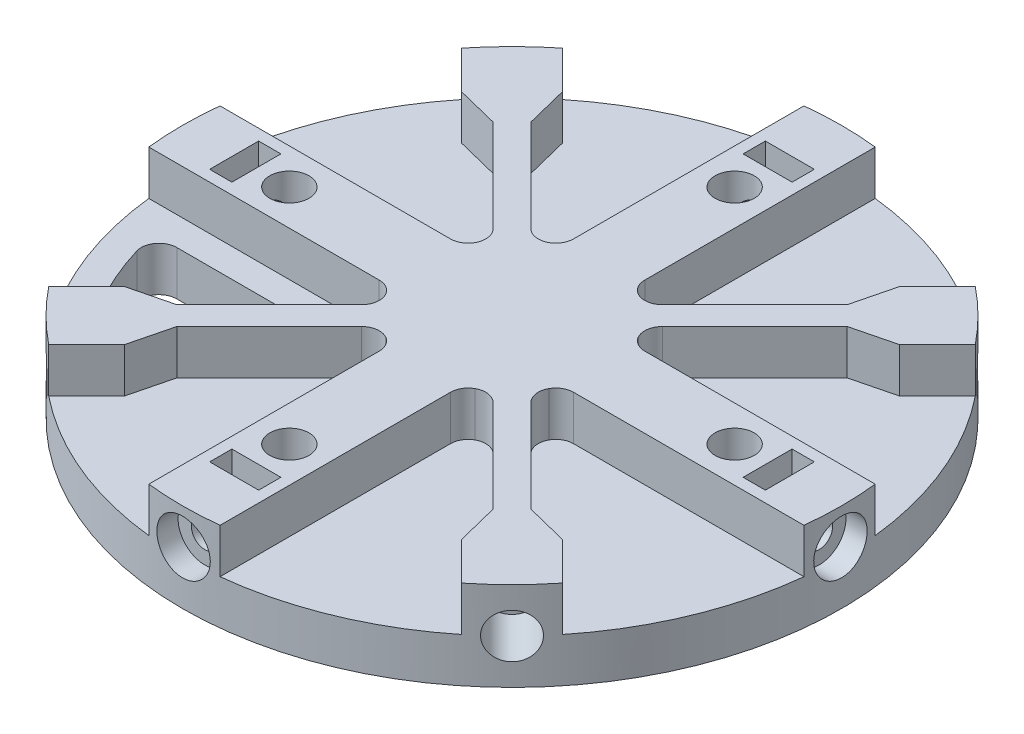
from build123d import *

# Parameters (mm, degrees)
SKETCH1_R                               = 37
BOSS_EXTRUDE1_DEPTH                     = 10
F_4_0MM_DOWEL_HOLE2_D                   = 4.4
CBORE_FOR_M6_HEX_HEAD_BOLT4_D           = 3
CBORE_FOR_M6_HEX_HEAD_BOLT4_DEPTH       = 11
CBORE_FOR_M6_HEX_HEAD_BOLT4_CBORE_D     = 6
CBORE_FOR_M6_HEX_HEAD_BOLT4_CBORE_DEPTH = 2.5
CIRPATTERN1_COUNT                       = 4
SKETCH18_R                              = 2.5
CUT_EXTRUDE2_DEPTH                      = 6.5
CUT_EXTRUDE3_START                      = -5
CUT_EXTRUDE3_DEPTH                      = 5
CIRPATTERN4_COUNT                       = 4
CIRPATTERN4_ANGLE                       = 270
CIRPATTERN2_COUNT                       = 4
BOSS_EXTRUDE5_DEPTH                     = 5
CHAMFER1_SIZE                           = 5
CHAMFER1_SIZE_2                         = 3
CHAMFER2_SIZE                           = 5
CHAMFER2_SIZE_2                         = 3
CUT_EXTRUDE9_DEPTH                      = 2.5
CIRPATTERN8_COUNT                       = 4
FILLET15_R                              = 2
CUT_EXTRUDE12_DEPTH                     = 5
FILLET16_R                              = 2


with BuildPart() as part:
    # Sketch1 → Boss-Extrude1 (new body)
    with BuildSketch(Plane(origin=(0, 0, 0), x_dir=(1, 0, 0), z_dir=(0, 1, 0))):
        with Locations(Location((0, 0, 0), (0, 0, 270))):
            Circle(SKETCH1_R)
    extrude(amount=BOSS_EXTRUDE1_DEPTH)

    # Ø4.0mm Dowel Hole2 (through all)
    with Locations(Plane(origin=(0, 10, 0), x_dir=(1, 0, 0), z_dir=(0, 1, 0))):
        with Locations((0, 25), (25, 0), (0, -25), (-25, 0)):
            Hole(F_4_0MM_DOWEL_HOLE2_D / 2)

    # CBORE for M6 Hex Head Bolt4
    with Locations(Plane(origin=(37, 0, 0), x_dir=(0, 0, -1), z_dir=(1, 0, 0))):
        with Locations((0, 6)):
            cbore_for_m6_hex_head_bolt4 = CounterBoreHole(CBORE_FOR_M6_HEX_HEAD_BOLT4_D / 2, CBORE_FOR_M6_HEX_HEAD_BOLT4_CBORE_D / 2, CBORE_FOR_M6_HEX_HEAD_BOLT4_CBORE_DEPTH, depth=CBORE_FOR_M6_HEX_HEAD_BOLT4_DEPTH)

    # CirPattern1: CBORE for M6 Hex Head Bolt4 ×4 about axis
    cirpattern1_axis = Axis((0, 0, 0), (0, 1, 0))
    for i in range(1, CIRPATTERN1_COUNT):
        add(cbore_for_m6_hex_head_bolt4.rotate(cirpattern1_axis, i * 360 / CIRPATTERN1_COUNT), mode=Mode.SUBTRACT)

    # Sketch18 → Cut-Extrude2 (cut)
    with BuildSketch(Plane(origin=(26.162950904, 0, 26.162950904), x_dir=(0, -1, 0), z_dir=(0.7071067811865464, 0, 0.7071067811865488))):
        with Locations(Location((-5, 0, 0), (0, 0, 90))):
            Circle(SKETCH18_R)
    cut_extrude2 = extrude(amount=-CUT_EXTRUDE2_DEPTH, mode=Mode.SUBTRACT)

    # Sketch19 → Cut-Extrude3 (cut)
    with BuildSketch(Plane(origin=(0, 10, 0), x_dir=(1, 0, 0), z_dir=(0, 1, 0)).offset(CUT_EXTRUDE3_START)):
        with BuildLine():
            Line((-36.783148315, -4), (-9.656854249, -4))
            ThreePointArc((-9.656854249, -4), (-7.39103626, -7.39103626), (-4, -9.656854249))
            Line((-4, -9.656854249), (-4, -36.783148315))
            ThreePointArc((-4, -36.783148315), (-14.159286998, -34.183542703), (-23.181186483, -28.838040732))
            Line((-23.181186483, -28.838040732), (-15.403011889, -21.059866139))
            Line((-15.403011889, -21.059866139), (-21.059866139, -15.403011889))
            Line((-21.059866139, -15.403011889), (-28.838040732, -23.181186483))
            ThreePointArc((-28.838040732, -23.181186483), (-34.183542703, -14.159286998), (-36.783148315, -4))
        make_face()
    cut_extrude3 = extrude(amount=CUT_EXTRUDE3_DEPTH, mode=Mode.SUBTRACT)

    # CirPattern4: Cut-Extrude3 ×4 about axis
    cirpattern4_axis = Axis((0, 0, 0), (0, 1, 0))
    for i in range(1, CIRPATTERN4_COUNT):
        add(cut_extrude3.rotate(cirpattern4_axis, i * CIRPATTERN4_ANGLE / (CIRPATTERN4_COUNT - 1)), mode=Mode.SUBTRACT)

    # CirPattern2: Cut-Extrude2 ×4 about axis
    cirpattern2_axis = Axis((0, 0, 0), (0, 1, 0))
    for i in range(1, CIRPATTERN2_COUNT):
        add(cut_extrude2.rotate(cirpattern2_axis, i * 360 / CIRPATTERN2_COUNT), mode=Mode.SUBTRACT)

    # Sketch21 → Boss-Extrude5 (add)
    with BuildSketch(Plane(origin=(0, 5, 0), x_dir=(1, 0, 0), z_dir=(0, 1, 0))):
        with BuildLine():
            Line((-19.292099186, -17.170778842), (-8.375194812, -6.253874468))
            ThreePointArc((-8.375194812, -6.253874468), (-7.39103626, -7.39103626), (-6.253874468, -8.375194812))
            Line((-6.253874468, -8.375194812), (-17.170778842, -19.292099186))
            Line((-17.170778842, -19.292099186), (-19.292099186, -17.170778842))
        make_face()
        with BuildLine():
            Line((19.292099186, -17.170778842), (8.375194812, -6.253874468))
            ThreePointArc((8.375194812, -6.253874468), (7.39103626, -7.39103626), (6.253874468, -8.375194812))
            Line((6.253874468, -8.375194812), (17.170778842, -19.292099186))
            Line((17.170778842, -19.292099186), (19.292099186, -17.170778842))
        make_face()
        with BuildLine():
            Line((6.253874468, 8.375194812), (17.170778842, 19.292099186))
            Line((17.170778842, 19.292099186), (19.292099186, 17.170778842))
            Line((19.292099186, 17.170778842), (8.375194812, 6.253874468))
            ThreePointArc((8.375194812, 6.253874468), (7.39103626, 7.39103626), (6.253874468, 8.375194812))
        make_face()
        with BuildLine():
            Line((-19.292099186, 17.170778842), (-8.375194812, 6.253874468))
            ThreePointArc((-8.375194812, 6.253874468), (-7.39103626, 7.39103626), (-6.253874468, 8.375194812))
            Line((-6.253874468, 8.375194812), (-17.170778842, 19.292099186))
            Line((-17.170778842, 19.292099186), (-19.292099186, 17.170778842))
        make_face()
    extrude(amount=BOSS_EXTRUDE5_DEPTH)

    # Chamfer1
    # the kernel refuses this chamfer: 5, 3 mm, written as the material it takes off along each edge
    with BuildSketch(Plane(origin=(15.403011889, 5, -21.059866139), x_dir=(0.6929000778052362, 0, -0.721033620698437), z_dir=(0, 1, 0))) as chamfer1_piece_1_section:
        Polygon((CHAMFER1_SIZE * 0.99980210636, -CHAMFER1_SIZE * 0.0198934189586), (-CHAMFER1_SIZE_2 * 0.0198934189586, -CHAMFER1_SIZE_2 * 0.99980210636), (0, 0), align=None)
    chamfer1_piece_1 = extrude(amount=17.931305486, mode=Mode.PRIVATE)
    chamfer1_piece_1 = split(chamfer1_piece_1, bisect_by=Plane(origin=(18.377349937, 7.5, -20.498670281), z_dir=(-0.7071067811865474, 0, -0.7071067811865478)), keep=Keep.TOP, mode=Mode.PRIVATE)
    add(chamfer1_piece_1, mode=Mode.SUBTRACT)
    with BuildSketch(Plane(origin=(21.059866139, 5, 15.403011889), x_dir=(0.7210336206984348, 0, 0.6929000778052385), z_dir=(0, 1, 0))) as chamfer1_piece_2_section:
        Polygon((CHAMFER1_SIZE * 0.99980210636, -CHAMFER1_SIZE * 0.0198934189586), (-CHAMFER1_SIZE_2 * 0.0198934189586, -CHAMFER1_SIZE_2 * 0.99980210636), (0, 0), align=None)
    chamfer1_piece_2 = extrude(amount=17.931305486, mode=Mode.PRIVATE)
    chamfer1_piece_2 = split(chamfer1_piece_2, bisect_by=Plane(origin=(20.498670281, 7.5, 18.377349937), z_dir=(0.7071067811865472, 0, -0.7071067811865479)), keep=Keep.TOP, mode=Mode.PRIVATE)
    add(chamfer1_piece_2, mode=Mode.SUBTRACT)
    with BuildSketch(Plane(origin=(-15.403011889, 5, 21.059866139), x_dir=(-0.6929000778052419, 0, 0.7210336206984316), z_dir=(0, 1, 0))) as chamfer1_piece_3_section:
        Polygon((CHAMFER1_SIZE * 0.99980210636, -CHAMFER1_SIZE * 0.0198934189586), (-CHAMFER1_SIZE_2 * 0.0198934189586, -CHAMFER1_SIZE_2 * 0.99980210636), (0, 0), align=None)
    chamfer1_piece_3 = extrude(amount=17.931305486, mode=Mode.PRIVATE)
    chamfer1_piece_3 = split(chamfer1_piece_3, bisect_by=Plane(origin=(-18.377349937, 7.5, 20.498670281), z_dir=(0.7071067811865476, 0, 0.7071067811865475)), keep=Keep.TOP, mode=Mode.PRIVATE)
    add(chamfer1_piece_3, mode=Mode.SUBTRACT)
    with BuildSketch(Plane(origin=(-21.059866139, 5, -15.403011889), x_dir=(-0.7210336206984393, 0, -0.6929000778052339), z_dir=(0, 1, 0))) as chamfer1_piece_4_section:
        Polygon((CHAMFER1_SIZE * 0.99980210636, -CHAMFER1_SIZE * 0.0198934189586), (-CHAMFER1_SIZE_2 * 0.0198934189586, -CHAMFER1_SIZE_2 * 0.99980210636), (0, 0), align=None)
    chamfer1_piece_4 = extrude(amount=17.931305486, mode=Mode.PRIVATE)
    chamfer1_piece_4 = split(chamfer1_piece_4, bisect_by=Plane(origin=(-20.498670281, 7.5, -18.377349937), z_dir=(-0.7071067811865476, 0, 0.7071067811865476)), keep=Keep.TOP, mode=Mode.PRIVATE)
    add(chamfer1_piece_4, mode=Mode.SUBTRACT)

    # Chamfer2
    # the kernel refuses this chamfer: 5, 3 mm, written as the material it takes off along each edge
    with BuildSketch(Plane(origin=(21.059866139, 5, -15.403011889), x_dir=(0.7210336206984341, 0, -0.6929000778052392), z_dir=(0, 1, 0))) as chamfer2_piece_1_section:
        Polygon((CHAMFER2_SIZE * 0.99980210636, CHAMFER2_SIZE * 0.0198934189586), (-CHAMFER2_SIZE_2 * 0.0198934189586, CHAMFER2_SIZE_2 * 0.99980210636), (0, 0), align=None)
    chamfer2_piece_1 = extrude(amount=17.931305486, mode=Mode.PRIVATE)
    chamfer2_piece_1 = split(chamfer2_piece_1, bisect_by=Plane(origin=(20.498670281, 7.5, -18.377349937), z_dir=(0.7071067811865472, 0, 0.7071067811865479)), keep=Keep.TOP, mode=Mode.PRIVATE)
    add(chamfer2_piece_1, mode=Mode.SUBTRACT)
    with BuildSketch(Plane(origin=(15.403011889, 5, 21.059866139), x_dir=(0.692900077805237, 0, 0.7210336206984364), z_dir=(0, 1, 0))) as chamfer2_piece_2_section:
        Polygon((CHAMFER2_SIZE * 0.99980210636, CHAMFER2_SIZE * 0.0198934189586), (-CHAMFER2_SIZE_2 * 0.0198934189586, CHAMFER2_SIZE_2 * 0.99980210636), (0, 0), align=None)
    chamfer2_piece_2 = extrude(amount=17.931305486, mode=Mode.PRIVATE)
    chamfer2_piece_2 = split(chamfer2_piece_2, bisect_by=Plane(origin=(18.377349937, 7.5, 20.498670281), z_dir=(-0.7071067811865474, 0, 0.7071067811865478)), keep=Keep.TOP, mode=Mode.PRIVATE)
    add(chamfer2_piece_2, mode=Mode.SUBTRACT)
    with BuildSketch(Plane(origin=(-21.059866139, 5, 15.403011889), x_dir=(-0.7210336206984388, 0, 0.6929000778052343), z_dir=(0, 1, 0))) as chamfer2_piece_3_section:
        Polygon((CHAMFER2_SIZE * 0.99980210636, CHAMFER2_SIZE * 0.0198934189586), (-CHAMFER2_SIZE_2 * 0.0198934189586, CHAMFER2_SIZE_2 * 0.99980210636), (0, 0), align=None)
    chamfer2_piece_3 = extrude(amount=17.931305486, mode=Mode.PRIVATE)
    chamfer2_piece_3 = split(chamfer2_piece_3, bisect_by=Plane(origin=(-20.498670281, 7.5, 18.377349937), z_dir=(-0.7071067811865476, 0, -0.7071067811865476)), keep=Keep.TOP, mode=Mode.PRIVATE)
    add(chamfer2_piece_3, mode=Mode.SUBTRACT)
    with BuildSketch(Plane(origin=(-15.403011889, 5, -21.059866139), x_dir=(-0.6929000778052418, 0, -0.7210336206984318), z_dir=(0, 1, 0))) as chamfer2_piece_4_section:
        Polygon((CHAMFER2_SIZE * 0.99980210636, CHAMFER2_SIZE * 0.0198934189586), (-CHAMFER2_SIZE_2 * 0.0198934189586, CHAMFER2_SIZE_2 * 0.99980210636), (0, 0), align=None)
    chamfer2_piece_4 = extrude(amount=17.931305486, mode=Mode.PRIVATE)
    chamfer2_piece_4 = split(chamfer2_piece_4, bisect_by=Plane(origin=(-18.377349937, 7.5, -20.498670281), z_dir=(0.7071067811865476, 0, -0.7071067811865475)), keep=Keep.TOP, mode=Mode.PRIVATE)
    add(chamfer2_piece_4, mode=Mode.SUBTRACT)

    # Sketch36 → Cut-Extrude9 (cut)
    with BuildSketch(Plane(origin=(0, 0, 28.7), x_dir=(-1, 0, 0), z_dir=(0, 0, -1))):
        Polygon((-2.75, 10), (-2.75, 4.41228676), (0, 2.824573519), (2.75, 4.41228676), (2.75, 10), align=None)
    cut_extrude9 = extrude(amount=-CUT_EXTRUDE9_DEPTH, mode=Mode.SUBTRACT)

    # CirPattern8: Cut-Extrude9 ×4 about axis
    cirpattern8_axis = Axis((0, 0, 0), (0, 1, 0))
    for i in range(1, CIRPATTERN8_COUNT):
        add(cut_extrude9.rotate(cirpattern8_axis, i * 360 / CIRPATTERN8_COUNT), mode=Mode.SUBTRACT)

    # Fillet15
    # the kernel refuses this fillet: 2 mm, written as the material it adds along each edge
    with BuildSketch(Plane(origin=(6.253874468, 0.98449353, -8.375194812), x_dir=(-0.8413917030677118, 0, -0.5404257599419328), z_dir=(0, 1, 0)), Plane(origin=(8.375194812, 0.98449353, 6.253874468), x_dir=(0.5404257599419334, 0, -0.8413917030677115), z_dir=(0, 1, 0))) as fillet15_piece_1:
        with BuildLine():
            CenterArc((1.612360898, -1.995038618), FILLET15_R, 94.036581983, 73.676044891)
            Line((-0.341824099, -1.5694085), (0, 0))
            ThreePointArc((0, 0), (0.735787069, -0.025929431), (1.471574137, 0))
        make_face()
    extrude(amount=9.01550647)
    with BuildSketch(Plane(origin=(8.375194812, 0.98449353, -6.253874468), x_dir=(0.7071067811865476, 0, -0.7071067811865476), z_dir=(0, 1, 0)), Plane(origin=(-6.253874468, 0.98449353, -8.375194812), x_dir=(-0.7071067811865476, 0, -0.7071067811865476), z_dir=(0, 1, 0))) as fillet15_piece_2:
        with BuildLine():
            CenterArc((1.606202588, -2), FILLET15_R, 90, 73.676044891)
            ThreePointArc((-0.313173137, -1.437864051), (-0.131251116, -0.724450199), (0, 0))
            Line((0, 0), (1.606202588, 0))
        make_face()
    extrude(amount=9.01550647)
    with BuildSketch(Plane(origin=(9.656854249, 1.862925491, -4), x_dir=(1, 0, 0), z_dir=(0, 1, 0)), Plane(origin=(4, 1.862925491, 9.656854249), x_dir=(0, 0, 1), z_dir=(0, 1, 0)), Plane(origin=(-9.656854249, 1.862925491, 4), x_dir=(-1, 0, 0), z_dir=(0, 1, 0)), Plane(origin=(-4, 1.862925491, -9.656854249), x_dir=(0, 0, -1), z_dir=(0, 1, 0))) as fillet15_piece_3:
        with BuildLine():
            CenterArc((1.254829803, 2), FILLET15_R, 208.805043762, 61.194956238)
            ThreePointArc((-0.497698732, 1.036338373), (-0.234590445, 0.525016995), (0, 0))
            Line((0, 0), (1.254829803, 0))
        make_face()
    extrude(amount=8.137074509)
    with BuildSketch(Plane(origin=(9.656854249, 1.862925491, 4), x_dir=(1, 0, 0), z_dir=(0, 1, 0)), Plane(origin=(-4, 1.862925491, 9.656854249), x_dir=(0, 0, 1), z_dir=(0, 1, 0)), Plane(origin=(4, 1.862925491, -9.656854249), x_dir=(0, 0, -1), z_dir=(0, 1, 0)), Plane(origin=(-9.656854249, 1.862925491, -4), x_dir=(-1, 0, 0), z_dir=(0, 1, 0))) as fillet15_piece_4:
        with BuildLine():
            CenterArc((1.254829803, -2), FILLET15_R, 90, 61.194956238)
            ThreePointArc((-0.497698732, -1.036338373), (-0.234590445, -0.525016995), (0, 0))
            Line((0, 0), (1.254829803, 0))
        make_face()
    extrude(amount=8.137074509)
    with BuildSketch(Plane(origin=(6.253874468, 0.98449353, 8.375194812), x_dir=(-0.8413917030676887, 0, 0.5404257599419685), z_dir=(0, 1, 0)), Plane(origin=(-8.375194812, 0.98449353, 6.253874468), x_dir=(-0.5404257599419688, 0, -0.8413917030676886), z_dir=(0, 1, 0))) as fillet15_piece_5:
        with BuildLine():
            CenterArc((1.612360898, 1.995038618), FILLET15_R, 192.287373126, 73.676044891)
            Line((-0.341824099, 1.5694085), (0, 0))
            ThreePointArc((0, 0), (0.735787069, 0.025929431), (1.471574137, 0))
        make_face()
    extrude(amount=9.01550647)
    with BuildSketch(Plane(origin=(-6.253874468, 0.98449353, 8.375194812), x_dir=(-0.7071067811865479, 0, 0.7071067811865474), z_dir=(0, 1, 0)), Plane(origin=(-8.375194812, 0.98449353, -6.253874468), x_dir=(-0.7071067811865476, 0, -0.7071067811865476), z_dir=(0, 1, 0))) as fillet15_piece_6:
        with BuildLine():
            CenterArc((1.606202588, 2), FILLET15_R, 196.323955109, 73.676044891)
            ThreePointArc((-0.313173137, 1.437864051), (-0.131251116, 0.724450199), (0, 0))
            Line((0, 0), (1.606202588, 0))
        make_face()
    extrude(amount=9.01550647)

    # Sketch44 → Cut-Extrude12 (cut)
    with BuildSketch(Plane(origin=(0, 5, 0), x_dir=(1, 0, 0), z_dir=(0, 1, 0))):
        with BuildLine():
            Line((-21.517353369, -14.870549626), (-29.317381734, -16.820556717))
            ThreePointArc((-29.317381734, -16.820556717), (-31.539784815, -12.152447235), (-33.024233526, -7.2))
            Line((-33.024233526, -7.2), (-13.846803743, -7.2))
            Line((-13.846803743, -7.2), (-21.517353369, -14.870549626))
        make_face()
    extrude(amount=-CUT_EXTRUDE12_DEPTH, mode=Mode.SUBTRACT)

    # Fillet16
    fillet16_edges = [part.edges().sort_by_distance(p)[0] for p in [
        (-29.317381734, 2.5, 16.820556717),
        (-33.024233526, 2.5, 7.2),
        (-13.846803743, 2.5, 7.2),
        (-21.517353369, 2.5, 14.870549626),
    ]]
    fillet(fillet16_edges, radius=FILLET16_R)


solid = part.part
